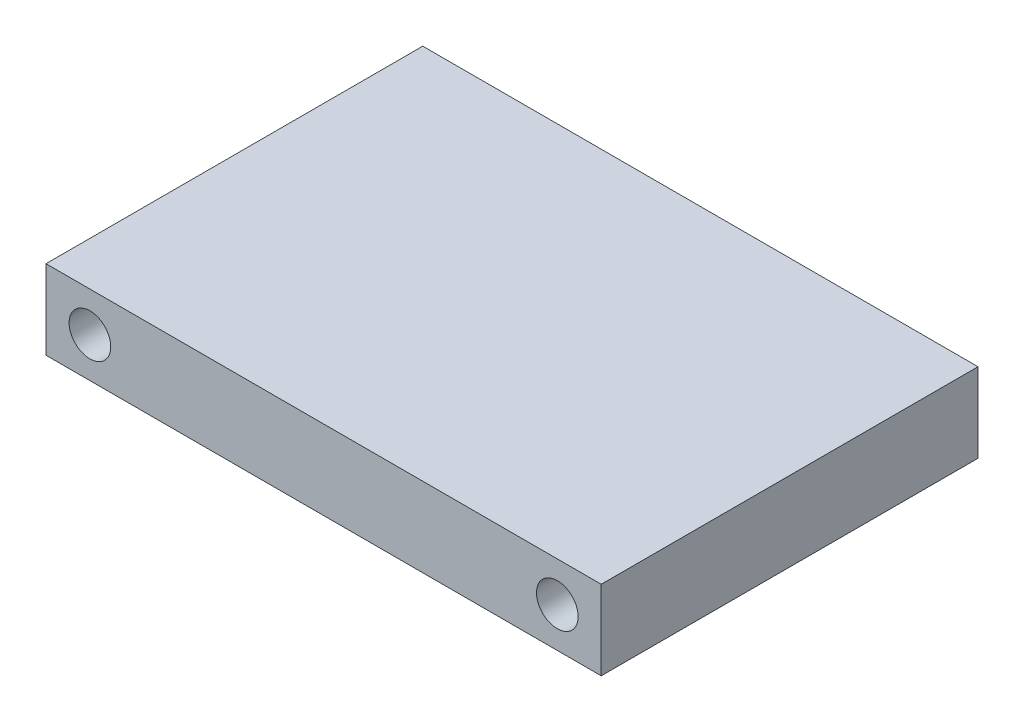
from build123d import *

# Parameters (mm, degrees)
SKETCH_1_W          = 56
SKETCH_1_H          = 8
EXTRUDE_1_DEPTH     = 38
SKETCH_2_R          = 2.1
CUT_EXTRUDE_1_DEPTH = 69.14690015


with BuildPart() as part:
    # Эскиз1 → Бобышка-Вытянуть1 (new body)
    with BuildSketch(Plane.XY):
        with Locations((28, 4)):
            Rectangle(SKETCH_1_W, SKETCH_1_H)
    extrude(amount=EXTRUDE_1_DEPTH)

    # Эскиз2 → Вырез-Вытянуть1 (cut, through all)
    with BuildSketch(Plane.XY.offset(38)):
        with Locations((4.43, 4)):
            Circle(SKETCH_2_R)
        with Locations((51.57, 4)):
            Circle(SKETCH_2_R)
    extrude(amount=-CUT_EXTRUDE_1_DEPTH, mode=Mode.SUBTRACT)


solid = part.part
